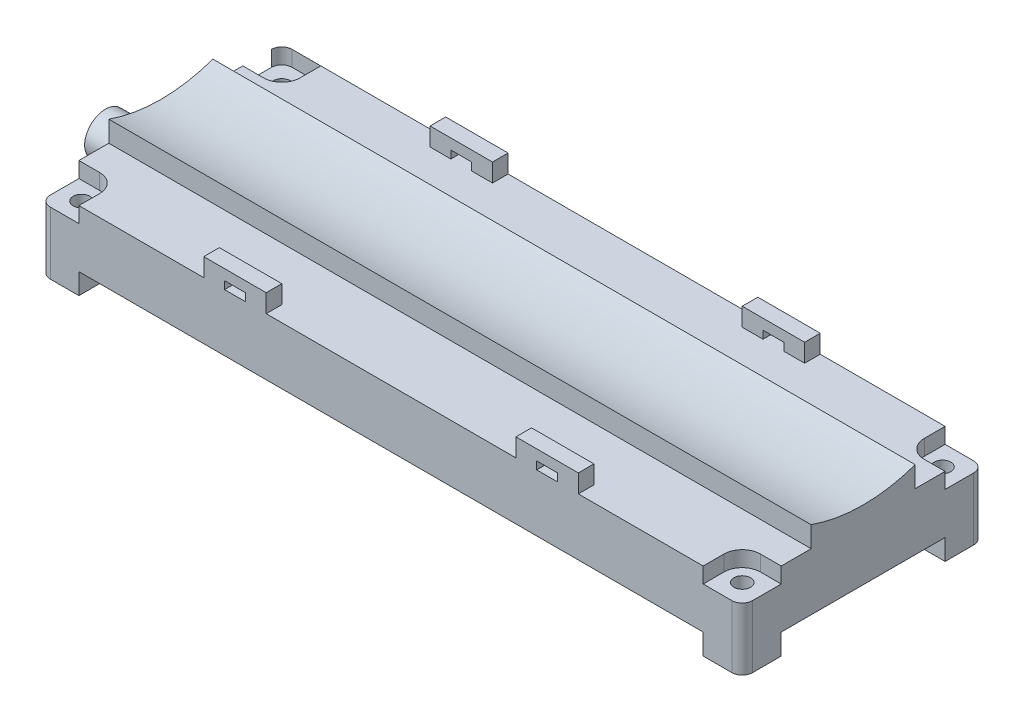
from build123d import *
from build123d.topology import SkipClean

# Parameters (mm, degrees)
BOSS_EXTRUDE1_DEPTH     = 11
SHELL1_T                = -1
BOSS_EXTRUDE2_START     = 14
BOSS_EXTRUDE2_DEPTH     = 14
BOSS_EXTRUDE3_START     = 4
BOSS_EXTRUDE3_DEPTH     = 4
CUT_EXTRUDE1_DEPTH      = 73.950753937
CUT_EXTRUDE1_DEPTH_BACK = 73.950753937
SKETCH5_R               = 1.6
CUT_EXTRUDE3_START      = -3
CUT_EXTRUDE3_DEPTH      = 3
SKETCH13_R              = 2.75
BOSS_EXTRUDE4_DEPTH     = 2
SKETCH14_R              = 4
BOSS_EXTRUDE5_DEPTH     = 6
BOSS_EXTRUDE6_START     = -135
BOSS_EXTRUDE6_DEPTH     = 135
BOSS_EXTRUDE7_DEPTH     = 3


with BuildPart() as part:
    # Sketch1 → Boss-Extrude1 (new body)
    with BuildSketch(Plane(origin=(0, 0, 0), x_dir=(1, 0, 0), z_dir=(0, 1, 0))):
        with BuildLine():
            Line((65.5, -23.25), (-65.5, -23.25))
            ThreePointArc((-65.5, -23.25), (-66.914213562, -22.664213562), (-67.5, -21.25))
            Line((-67.5, -21.25), (-67.5, 21.25))
            ThreePointArc((-67.5, 21.25), (-66.914213562, 22.664213562), (-65.5, 23.25))
            Line((-65.5, 23.25), (65.5, 23.25))
            ThreePointArc((65.5, 23.25), (66.914213562, 22.664213562), (67.5, 21.25))
            Line((67.5, 21.25), (67.5, -21.25))
            ThreePointArc((67.5, -21.25), (66.914213562, -22.664213562), (65.5, -23.25))
        make_face()
    extrude(amount=BOSS_EXTRUDE1_DEPTH)

    # Shell1
    shell1_openings = [part.faces().sort_by_distance(p)[0] for p in [
        (0, 0, 0),
    ]]
    offset(amount=SHELL1_T, openings=shell1_openings, kind=Kind.INTERSECTION)

    # Sketch4 → Boss-Extrude2 (add)
    with SkipClean():  # the faces are left unmerged after this step: merging them gives an invalid solid
        with BuildSketch(Plane.XZ.offset(-10).offset(BOSS_EXTRUDE2_START)):
            with BuildLine():
                Line((65.5, -23.25), (60, -23.25))
                Line((60, -23.25), (60, -19.25))
                ThreePointArc((60, -19.25), (61.025126266, -16.775126266), (63.5, -15.75))
                Line((63.5, -15.75), (67.5, -15.75))
                Line((67.5, -15.75), (67.5, -21.25))
                ThreePointArc((67.5, -21.25), (66.914213562, -22.664213562), (65.5, -23.25))
            make_face()
            with BuildLine():
                Line((65.5, 23.25), (60, 23.25))
                Line((60, 23.25), (60, 19.25))
                ThreePointArc((60, 19.25), (61.025126266, 16.775126266), (63.5, 15.75))
                Line((63.5, 15.75), (67.5, 15.75))
                Line((67.5, 15.75), (67.5, 21.25))
                ThreePointArc((67.5, 21.25), (66.914213562, 22.664213562), (65.5, 23.25))
            make_face()
            with BuildLine():
                Line((-67.5, -21.25), (-67.5, -15.75))
                Line((-67.5, -15.75), (-63.5, -15.75))
                ThreePointArc((-63.5, -15.75), (-61.025126266, -16.775126266), (-60, -19.25))
                Line((-60, -19.25), (-60, -23.25))
                Line((-60, -23.25), (-65.5, -23.25))
                ThreePointArc((-65.5, -23.25), (-66.914213562, -22.664213562), (-67.5, -21.25))
            make_face()
            with BuildLine():
                Line((-60, 19.25), (-60, 23.25))
                Line((-60, 23.25), (-65.5, 23.25))
                ThreePointArc((-65.5, 23.25), (-66.914213562, 22.664213562), (-67.5, 21.25))
                Line((-67.5, 21.25), (-67.5, 15.75))
                Line((-67.5, 15.75), (-63.5, 15.75))
                ThreePointArc((-63.5, 15.75), (-61.025126266, 16.775126266), (-60, 19.25))
            make_face()
        extrude(amount=-BOSS_EXTRUDE2_DEPTH)
    add(part.part.scale(1), mode=Mode.REPLACE)  # the faces are merged on a copy

    # Sketch7 → Boss-Extrude3 (add)
    with SkipClean():  # the faces are left unmerged after this step: merging them gives an invalid solid
        with BuildSketch(Plane.XZ.offset(-10).offset(BOSS_EXTRUDE3_START)):
            with BuildLine():
                Line((65.5, -23.25), (60, -23.25))
                Line((60, -23.25), (57, -23.25))
                Line((57, -23.25), (57, -19.633333333))
                Line((57, -19.633333333), (57, -19.25))
                ThreePointArc((57, -19.25), (58.903805922, -14.653805922), (63.5, -12.75))
                Line((63.5, -12.75), (67.5, -12.75))
                Line((67.5, -12.75), (67.5, -15.75))
                Line((67.5, -15.75), (67.5, -21.25))
                ThreePointArc((67.5, -21.25), (66.914213562, -22.664213562), (65.5, -23.25))
            make_face()
            with BuildLine():
                Line((65.5, 23.25), (60, 23.25))
                Line((60, 23.25), (57, 23.25))
                Line((57, 23.25), (57, 19.25))
                ThreePointArc((57, 19.25), (58.903805922, 14.653805922), (63.5, 12.75))
                Line((63.5, 12.75), (67.5, 12.75))
                Line((67.5, 12.75), (67.5, 15.75))
                Line((67.5, 15.75), (67.5, 21.25))
                ThreePointArc((67.5, 21.25), (66.914213562, 22.664213562), (65.5, 23.25))
            make_face()
            with BuildLine():
                Line((-67.5, -21.25), (-67.5, -15.75))
                Line((-67.5, -15.75), (-67.5, -12.75))
                Line((-67.5, -12.75), (-63.5, -12.75))
                ThreePointArc((-63.5, -12.75), (-58.903805922, -14.653805922), (-57, -19.25))
                Line((-57, -19.25), (-57, -23.25))
                Line((-57, -23.25), (-60, -23.25))
                Line((-60, -23.25), (-65.5, -23.25))
                ThreePointArc((-65.5, -23.25), (-66.914213562, -22.664213562), (-67.5, -21.25))
            make_face()
            with BuildLine():
                Line((-67.5, 15.75), (-67.5, 21.25))
                ThreePointArc((-67.5, 21.25), (-66.914213562, 22.664213562), (-65.5, 23.25))
                Line((-65.5, 23.25), (-60, 23.25))
                Line((-60, 23.25), (-57, 23.25))
                Line((-57, 23.25), (-57, 19.25))
                ThreePointArc((-57, 19.25), (-58.903805922, 14.653805922), (-63.5, 12.75))
                Line((-63.5, 12.75), (-67.5, 12.75))
                Line((-67.5, 12.75), (-67.5, 15.75))
            make_face()
        extrude(amount=-BOSS_EXTRUDE3_DEPTH)
    add(part.part.scale(1), mode=Mode.REPLACE)  # the faces are merged on a copy

    # Sketch5 → Cut-Extrude1 (cut, two sides: drawn at the far end of the back side and taken through both)
    with BuildSketch(Plane(origin=(0, 11, 0), x_dir=(1, 0, 0), z_dir=(0, 1, 0)).offset(-CUT_EXTRUDE1_DEPTH_BACK)):
        with Locations(Location((-63.5, 19.25, 0), (0, 0, 270))):
            Circle(SKETCH5_R)
        with Locations(Location((-63.5, -19.25, 0), (0, 0, 270))):
            Circle(SKETCH5_R)
        with Locations(Location((63.5, 19.25, 0), (0, 0, 270))):
            Circle(SKETCH5_R)
        with Locations(Location((63.5, -19.25, 0), (0, 0, 270))):
            Circle(SKETCH5_R)
    extrude(amount=CUT_EXTRUDE1_DEPTH + CUT_EXTRUDE1_DEPTH_BACK, mode=Mode.SUBTRACT)

    # Sketch12 → Cut-Extrude3 (cut)
    with BuildSketch(Plane(origin=(0, 11, 0), x_dir=(1, 0, 0), z_dir=(0, 1, 0)).offset(CUT_EXTRUDE3_START)):
        with BuildLine():
            Line((-63.5, 15.75), (-67.5, 15.75))
            Line((-67.5, 15.75), (-67.5, 21.25))
            ThreePointArc((-67.5, 21.25), (-66.914763627, 22.662885589), (-65.501878037, 23.248121963))
            Line((-65.501878037, 23.248121963), (-60, 23.248121963))
            Line((-60, 23.248121963), (-60, 19.25))
            ThreePointArc((-60, 19.25), (-61.025126266, 16.775126266), (-63.5, 15.75))
        make_face()
        with BuildLine():
            Line((-63.5, -15.75), (-67.5, -15.75))
            Line((-67.5, -15.75), (-67.5, -21.25))
            ThreePointArc((-67.5, -21.25), (-66.914213562, -22.664213562), (-65.5, -23.25))
            Line((-65.5, -23.25), (-60, -23.25))
            Line((-60, -23.25), (-60, -19.25))
            ThreePointArc((-60, -19.25), (-61.025126266, -16.775126266), (-63.5, -15.75))
        make_face()
        with BuildLine():
            Line((60, -19.25), (60, -23.25))
            Line((60, -23.25), (65.5, -23.25))
            ThreePointArc((65.5, -23.25), (66.914213562, -22.664213562), (67.5, -21.25))
            Line((67.5, -21.25), (67.5, -15.75))
            Line((67.5, -15.75), (63.5, -15.75))
            ThreePointArc((63.5, -15.75), (61.025126266, -16.775126266), (60, -19.25))
        make_face()
        with BuildLine():
            Line((60, 19.25), (60, 23.25))
            Line((60, 23.25), (65.5, 23.25))
            ThreePointArc((65.5, 23.25), (66.914213562, 22.664213562), (67.5, 21.25))
            Line((67.5, 21.25), (67.5, 15.75))
            Line((67.5, 15.75), (63.5, 15.75))
            ThreePointArc((63.5, 15.75), (61.025126266, 16.775126266), (60, 19.25))
        make_face()
    extrude(amount=CUT_EXTRUDE3_DEPTH, mode=Mode.SUBTRACT)

    # Sketch13 → Boss-Extrude4 (add)
    with BuildSketch(Plane.XZ.offset(-10)):
        with Locations(Location((-45.5, -7.4, 0), (0, 0, 270))):
            Circle(SKETCH13_R)
    extrude(amount=BOSS_EXTRUDE4_DEPTH)

    # Sketch14 → Boss-Extrude5 (add)
    with BuildSketch(Plane.ZY.offset(67.5)):
        with Locations(Location((4.65, 7, 0), (0, 0, 90))):
            Circle(SKETCH14_R)
    extrude(amount=BOSS_EXTRUDE5_DEPTH)

    # Sketch15 → Boss-Extrude6 (add)
    with BuildSketch(Plane(origin=(67.5, 0, 0), x_dir=(0, 0, -1), z_dir=(1, 0, 0)).offset(BOSS_EXTRUDE6_START)):
        with BuildLine():
            Line((-10, 15), (-10, 11))
            Line((-10, 11), (10, 11))
            Line((10, 11), (10, 15))
            ThreePointArc((10, 15), (0, 13.284271247), (-10, 15))
        make_face()
    extrude(amount=BOSS_EXTRUDE6_DEPTH)

    # Sketch16 → Boss-Extrude7 (add)
    with BuildSketch(Plane.XY.offset(23.25)):
        Polygon((-36, 11), (-32, 11), (-32, 12.5), (-28, 12.5), (-28, 11), (-24, 11), (-24, 14.5), (-36, 14.5), align=None)
        Polygon((24, 11), (28, 11), (28, 12.5), (32, 12.5), (32, 11), (36, 11), (36, 14.5), (24, 14.5), align=None)
    boss_extrude7 = extrude(amount=-BOSS_EXTRUDE7_DEPTH)

    # Mirror1: Boss-Extrude7 across plane
    add(boss_extrude7.mirror(Plane.XY))


solid = part.part
